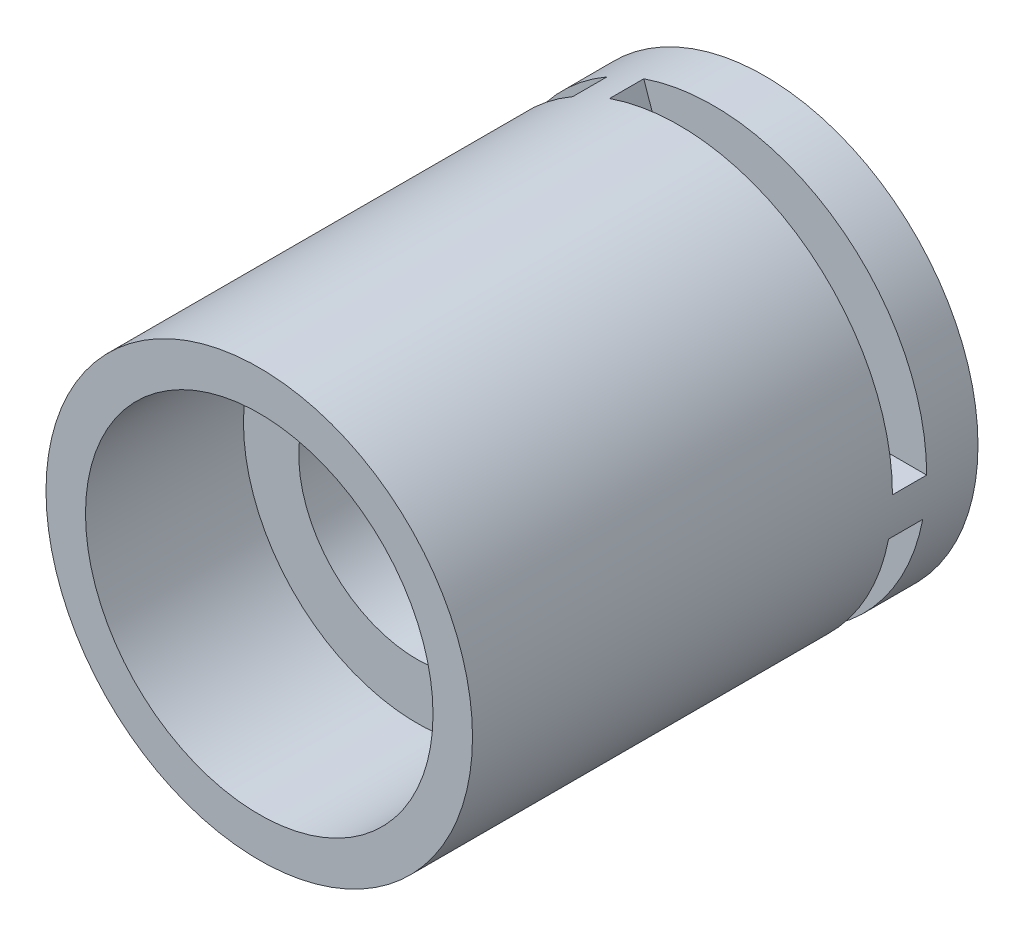
from build123d import *

# Parameters (mm, degrees)
SKETCH2_R           = 13.5
BOSS_EXTRUDE1_DEPTH = 32
SKETCH4_R           = 11
CUT_EXTRUDE1_DEPTH  = 10
SKETCH5_R           = 7.5
CUT_EXTRUDE2_DEPTH  = 30
WRAP1_SECTION_W     = 12
WRAP1_SECTION_H     = 2.166
WRAP1_ANGLE         = 109.116628984
CIRPATTERN1_COUNT   = 3


with BuildPart() as part:
    # Sketch2 → Boss-Extrude1 (new body)
    with BuildSketch(Plane.XY):
        Circle(SKETCH2_R)
    extrude(amount=-BOSS_EXTRUDE1_DEPTH)

    # Sketch4 → Cut-Extrude1 (cut)
    with BuildSketch(Plane.XY):
        Circle(SKETCH4_R)
    extrude(amount=-CUT_EXTRUDE1_DEPTH, mode=Mode.SUBTRACT)

    # Sketch5 → Cut-Extrude2 (cut)
    with BuildSketch(Plane.XY):
        Circle(SKETCH5_R)
    extrude(amount=-CUT_EXTRUDE2_DEPTH, mode=Mode.SUBTRACT)

    # Wrap1 section (on wrap section) → Wrap1 (revolve, cut)
    with BuildSketch(Plane(origin=(0, 0, 0), x_dir=(0.9999995414170643, -0.0009576876636740589, 0), z_dir=(-0.0009576876636740589, -0.9999995414170643, 0))):
        with Locations((7.5, -27.667)):
            Rectangle(WRAP1_SECTION_W, WRAP1_SECTION_H)
    wrap1 = revolve(axis=Axis((0, 0, 0), (0, 0, 1)), revolution_arc=WRAP1_ANGLE, mode=Mode.SUBTRACT)

    # CirPattern1: Wrap1 ×3 about axis
    cirpattern1_axis = Axis((0, 0, -32), (0, 0, 1))
    for i in range(1, CIRPATTERN1_COUNT):
        add(wrap1.rotate(cirpattern1_axis, i * 360 / CIRPATTERN1_COUNT), mode=Mode.SUBTRACT)


solid = part.part
